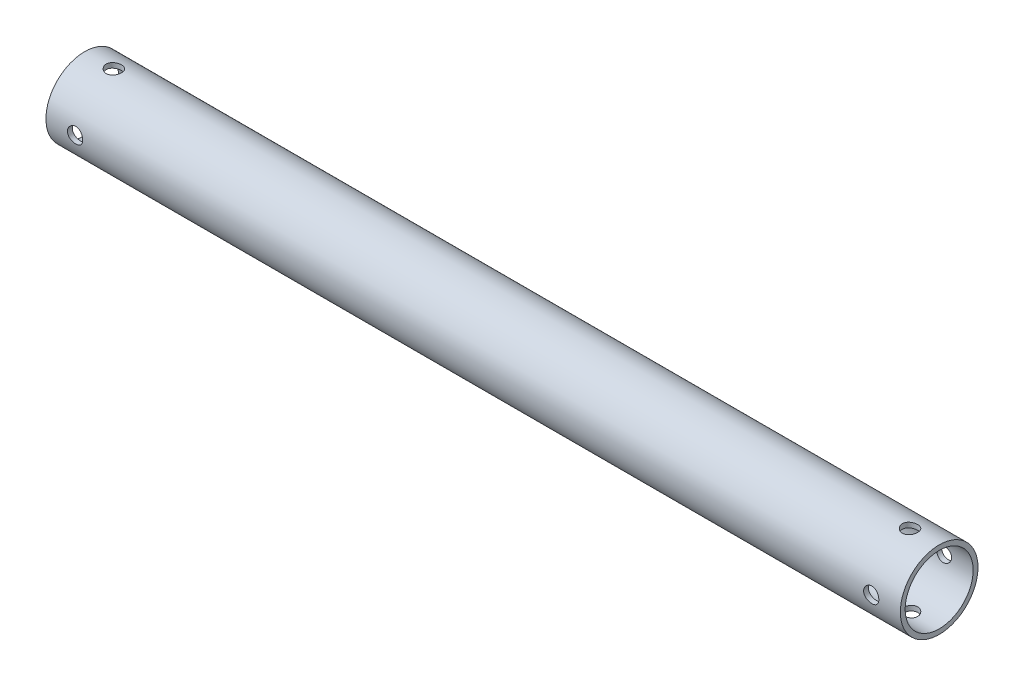
from build123d import *

# Parameters (mm, degrees)
SKETCH1_R               = 12.7
SKETCH1_R_2             = 11.1125
EXTRUDE_THIN1_DEPTH     = 139.7
CUT_EXTRUDE1_DEPTH      = 141.849813631
CUT_EXTRUDE1_DEPTH_BACK = 141.849813631
SKETCH3_R               = 2.4892
CUT_EXTRUDE2_DEPTH      = 141.849813749
CUT_EXTRUDE2_DEPTH_BACK = 141.849813749
SKETCH4_R               = 2.4892


with BuildPart() as part:
    # Sketch1 → Extrude-Thin1 (new, symmetric)
    with BuildSketch(Plane(origin=(0, 0, 0), x_dir=(0, 0, -1), z_dir=(1, 0, 0))):
        Circle(SKETCH1_R)
        Circle(SKETCH1_R_2, mode=Mode.SUBTRACT)
    extrude(amount=EXTRUDE_THIN1_DEPTH, both=True)

    # Sketch3 → Cut-Extrude1 (cut, two sides: drawn at the far end of the back side and taken through both)
    with BuildSketch(Plane.XY.offset(-CUT_EXTRUDE1_DEPTH_BACK)):
        with Locations((130.175, 0)):
            Circle(SKETCH3_R)
        with Locations((-130.175, 0)):
            Circle(SKETCH3_R)
    extrude(amount=CUT_EXTRUDE1_DEPTH + CUT_EXTRUDE1_DEPTH_BACK, mode=Mode.SUBTRACT)

    # Sketch4 → Cut-Extrude2 (cut, two sides: drawn at the far end of the back side and taken through both)
    with BuildSketch(Plane(origin=(0, 0, 0), x_dir=(1, 0, 0), z_dir=(0, 1, 0)).offset(-CUT_EXTRUDE2_DEPTH_BACK)):
        with Locations((130.175, 0)):
            Circle(SKETCH4_R)
        with Locations((-130.175, 0)):
            Circle(SKETCH4_R)
    extrude(amount=CUT_EXTRUDE2_DEPTH + CUT_EXTRUDE2_DEPTH_BACK, mode=Mode.SUBTRACT)


solid = part.part
